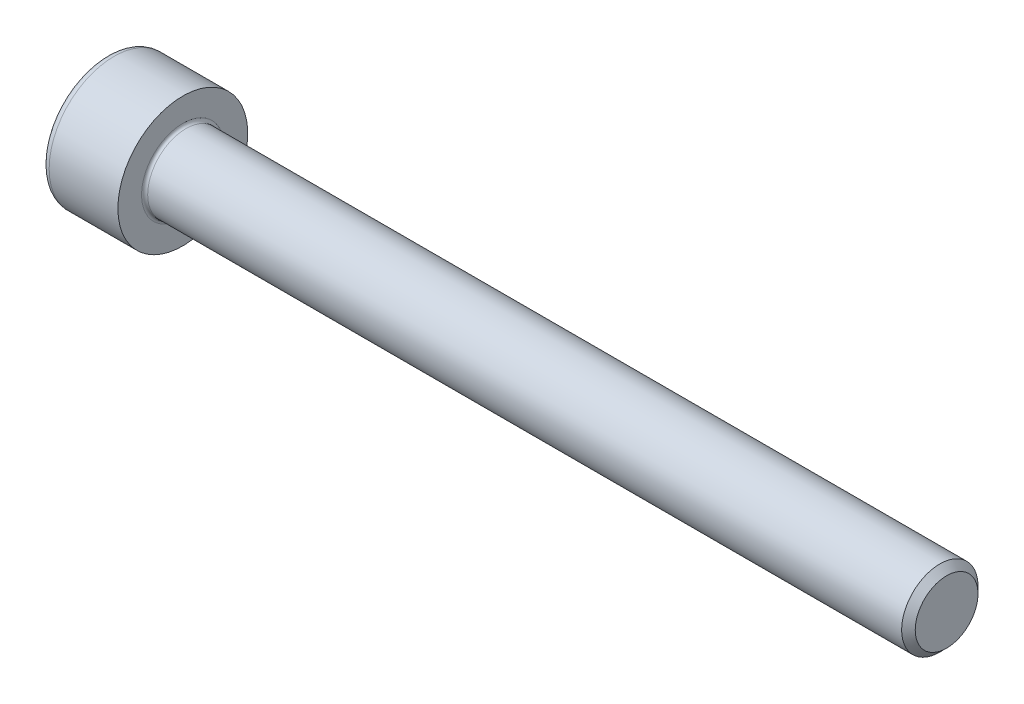
from build123d import *

# Parameters (mm, degrees)
FILLET1_R   = 0.2
FILLET2_R   = 0.5
HEX_2_DEPTH = 2.5


with BuildPart() as part:
    # BodySke → Base-Revolve (revolve)
    with BuildSketch(Plane.XY):
        Polygon((0, 0), (0, 4.25), (5, 4.25), (5, 2.5), (54.555, 2.5), (55, 2.055), (55, 0), align=None)
    revolve(axis=Axis((-31.75, 0, 0), (1, 0, 0)))

    # Fillet1
    fillet1_edges = [part.edges().sort_by_distance(p)[0] for p in [
        (5, -2.5, 0),
    ]]
    fillet(fillet1_edges, radius=FILLET1_R)

    # Fillet2
    fillet2_edges = [part.edges().sort_by_distance(p)[0] for p in [
        (0, -4.25, 0),
    ]]
    fillet(fillet2_edges, radius=FILLET2_R)

    # Sketch2 → Hex-PreBroach (revolve, cut)
    with BuildSketch(Plane.XY):
        Polygon((0, 2.01), (2.5, 2.01), (3.660474041, 0), (0, 0), align=None)
    revolve(axis=Axis((0, 0, 0), (1, 0, 0)), mode=Mode.SUBTRACT)

    # Sketch3 → Hex 2 (cut)
    with BuildSketch(Plane(origin=(0, 0, 0), x_dir=(0, 0.500000000000001, 0.866025403784438), z_dir=(-1, 0, 0))):
        Polygon((1.160474041, 2.01), (-1.160474041, 2.01), (-2.320948082, 0), (-1.160474041, -2.01), (1.160474041, -2.01), (2.320948082, 0), align=None)
    extrude(amount=-HEX_2_DEPTH, mode=Mode.SUBTRACT)


solid = part.part
